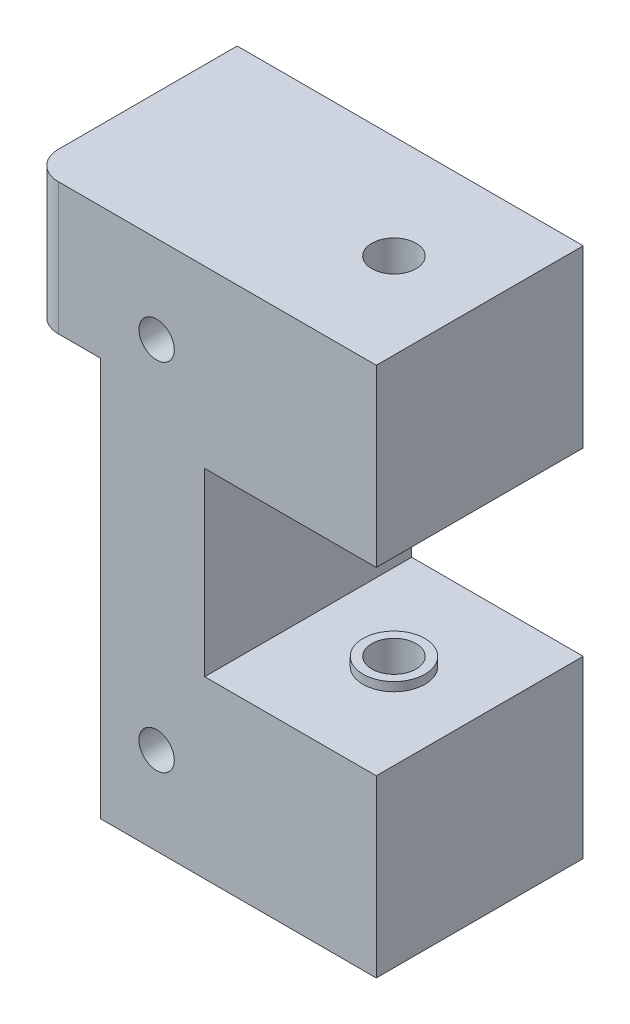
from build123d import *

# Parameters (mm, degrees)
MAINBLOCK_R                     = 2
MAINBLOCKBOSS_EXTRUDE1_DEPTH    = 23.4
TOPHOLECUT_SKETCH2_R            = 2.5
TOPHOLECUT_EXTRUDE1_DEPTH       = 45
TOPSPACERSKETCH4_R              = 3.5
TOPSPACERSKETCH4_R_2            = 2.5
TOPSPACERBOSS_EXTRUDE2_DEPTH    = 1
LOWERSPACERBOSS_EXTRUDE3_START  = 1
LOWERSPACERSKETCH5_R            = 3.5
LOWERSPACERSKETCH5_R_2          = 2.5
LOWERSPACERBOSS_EXTRUDE3_DEPTH  = 1
MOUNTHOLEBORECUT_EXTRUDE1_DEPTH = 2
PUSHPINHOLESKETCH1_R            = 1
PUSHPINHOLECUT_EXTRUDE1_DEPTH   = 76.354665582
MIDRAILINSETSKETCH1_W           = 7.9375
MIDRAILINSETSKETCH1_H           = 45.1
MIDRAILINSETCUT_EXTRUDE2_DEPTH  = 76.354665582
VERTICALSUPPORTFILLET1_R        = 3.175


with BuildPart() as part:
    # MainBlock → MainBlockBoss-Extrude1 (new body)
    with BuildSketch(Plane.XY):
        Polygon((0, 0), (39.125, 0), (39.125, 19.8), (19.725, 19.8), (19.725, 40.2), (39.125, 40.2), (39.125, 60), (0, 60), align=None)
        with Locations((14.2875, 50.1)):
            Circle(MAINBLOCK_R, mode=Mode.SUBTRACT)
        with Locations((14.2875, 9.9)):
            Circle(MAINBLOCK_R, mode=Mode.SUBTRACT)
    extrude(amount=MAINBLOCKBOSS_EXTRUDE1_DEPTH)

    # TopHoleCut-Sketch2 → TopHoleCut-Extrude1 (cut)
    with BuildSketch(Plane(origin=(0, 60, 0), x_dir=(1, 0, 0), z_dir=(0, 1, 0))):
        with Locations((29.425, -11.7)):
            Circle(TOPHOLECUT_SKETCH2_R)
    extrude(amount=-TOPHOLECUT_EXTRUDE1_DEPTH, mode=Mode.SUBTRACT)

    # TopSpacerSketch4 → TopSpacerBoss-Extrude2 (add)
    with BuildSketch(Plane.XZ.offset(-40.2)):
        with Locations((29.425, 11.7)):
            Circle(TOPSPACERSKETCH4_R)
        with Locations((29.425, 11.7)):
            Circle(TOPSPACERSKETCH4_R_2, mode=Mode.SUBTRACT)
    extrude(amount=TOPSPACERBOSS_EXTRUDE2_DEPTH)

    # LowerSpacerSketch5 → LowerSpacerBoss-Extrude3 (add)
    with BuildSketch(Plane(origin=(0, 19.8, 0), x_dir=(1, 0, 0), z_dir=(0, 1, 0)).offset(LOWERSPACERBOSS_EXTRUDE3_START)):
        with Locations((29.425, -11.7)):
            Circle(LOWERSPACERSKETCH5_R)
        with Locations((29.425, -11.7)):
            Circle(LOWERSPACERSKETCH5_R_2, mode=Mode.SUBTRACT)
    extrude(amount=-LOWERSPACERBOSS_EXTRUDE3_DEPTH)

    # MountHoleBoreSketch1 → MountHoleBoreCut-Extrude1 (cut)
    with BuildSketch(Plane(origin=(0, 0, 0), x_dir=(-1, 0, 0), z_dir=(0, 0, -1))):
        Polygon((-10.4125, 50.1), (-12.35, 53.45584844), (-16.225, 53.45584844), (-18.1625, 50.1), (-16.225, 46.74415156), (-12.35, 46.74415156), align=None)
        Polygon((-10.4125, 9.9), (-12.35, 13.25584844), (-16.225, 13.25584844), (-18.1625, 9.9), (-16.225, 6.54415156), (-12.35, 6.54415156), align=None)
    extrude(amount=-MOUNTHOLEBORECUT_EXTRUDE1_DEPTH, mode=Mode.SUBTRACT)

    # PushPinHoleSketch1 → PushPinHoleCut-Extrude1 (cut, through all)
    with BuildSketch(Plane.XZ):
        with Locations((29.425, 11.7)):
            Circle(PUSHPINHOLESKETCH1_R)
    extrude(amount=-PUSHPINHOLECUT_EXTRUDE1_DEPTH, mode=Mode.SUBTRACT)

    # MidRailInsetSketch1 → MidRailInsetCut-Extrude2 (cut, through all)
    with BuildSketch(Plane(origin=(0, 0, 0), x_dir=(-1, 0, 0), z_dir=(0, 0, -1))):
        with Locations((-3.96875, 22.55)):
            Rectangle(MIDRAILINSETSKETCH1_W, MIDRAILINSETSKETCH1_H)
    extrude(amount=-MIDRAILINSETCUT_EXTRUDE2_DEPTH, mode=Mode.SUBTRACT)

    # VerticalSupportFillet1
    verticalsupportfillet1_edges = [part.edges().sort_by_distance(p)[0] for p in [
        (0, 52.55, 23.4),
    ]]
    fillet(verticalsupportfillet1_edges, radius=VERTICALSUPPORTFILLET1_R)


solid = part.part
